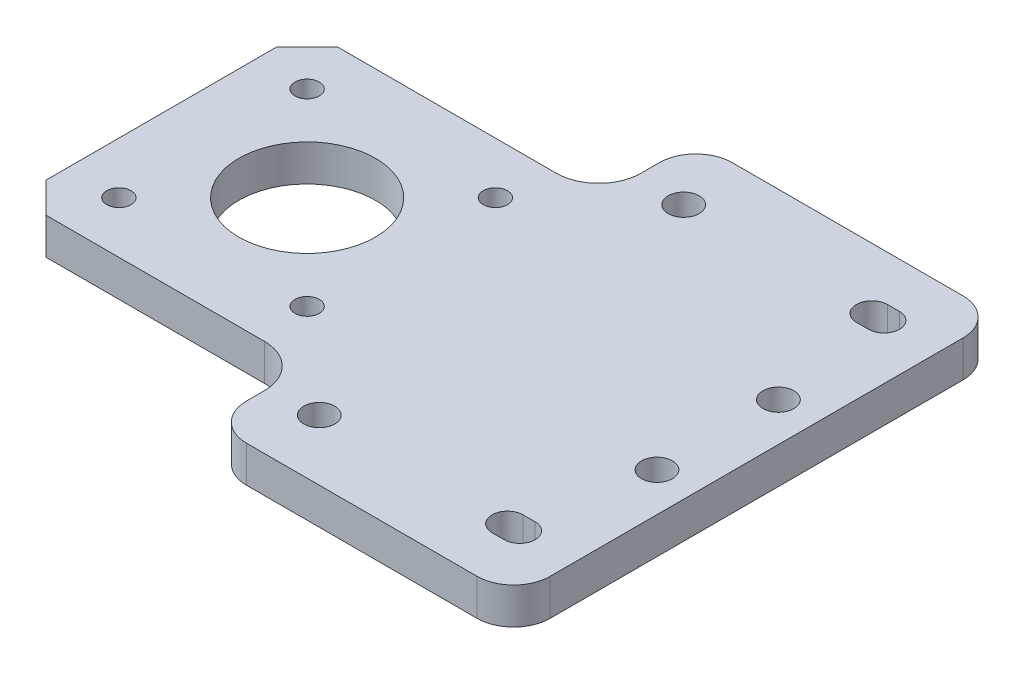
from build123d import *

# Parameters (mm, degrees)
SKETCH_1_R          = 11.25
SKETCH_1_R_2        = 2
SKETCH_1_R_3        = 2.55
EXTRUDE_1_DEPTH     = 6
SKETCH_2_R          = 2.55
CUT_EXTRUDE_1_DEPTH = 84.456575535


with BuildPart() as part:
    # Эскиз1 → Бобышка-Вытянуть1 (new body)
    with BuildSketch(Plane(origin=(0, 0, 0), x_dir=(1, 0, 0), z_dir=(0, 1, 0))):
        with BuildLine():
            Line((-32, -24), (-68, -24))
            Line((-68, -24), (-73, -19))
            Line((-73, -19), (-73, 19))
            Line((-73, 19), (-68, 24))
            Line((-68, 24), (-32, 24))
            ThreePointArc((-32, 24), (-27.050252532, 26.050252532), (-25, 31))
            Line((-25, 31), (-25, 34))
            ThreePointArc((-25, 34), (-23.242640687, 38.242640687), (-19, 40))
            Line((-19, 40), (19, 40))
            ThreePointArc((19, 40), (23.242640687, 38.242640687), (25, 34))
            Line((25, 34), (25, -34))
            ThreePointArc((25, -34), (23.242640687, -38.242640687), (19, -40))
            Line((19, -40), (-19, -40))
            ThreePointArc((-19, -40), (-23.242640687, -38.242640687), (-25, -34))
            Line((-25, -34), (-25, -31))
            ThreePointArc((-25, -31), (-27.050252532, -26.050252532), (-32, -24))
        make_face()
        with Locations((-49, 0)):
            Circle(SKETCH_1_R, mode=Mode.SUBTRACT)
        with Locations((-64.5, 15.5)):
            Circle(SKETCH_1_R_2, mode=Mode.SUBTRACT)
        with Locations((-64.5, -15.5)):
            Circle(SKETCH_1_R_2, mode=Mode.SUBTRACT)
        with Locations((-33.5, 15.5)):
            Circle(SKETCH_1_R_2, mode=Mode.SUBTRACT)
        with Locations((-33.5, -15.5)):
            Circle(SKETCH_1_R_2, mode=Mode.SUBTRACT)
        with Locations((18.604999999, -10)):
            Circle(SKETCH_1_R_3, mode=Mode.SUBTRACT)
        with Locations((18.604999999, 10)):
            Circle(SKETCH_1_R_3, mode=Mode.SUBTRACT)
    extrude(amount=EXTRUDE_1_DEPTH)

    # Эскиз2 → Вырез-Вытянуть1 (cut, through all)
    with BuildSketch(Plane.XZ):
        with Locations((-17, -30)):
            Circle(SKETCH_2_R)
        with Locations((-17, 30)):
            Circle(SKETCH_2_R)
        with BuildLine():
            Line((16, -32.55), (14, -32.55))
            ThreePointArc((14, -32.55), (11.45, -30), (14, -27.45))
            Line((14, -27.45), (16, -27.45))
            ThreePointArc((16, -27.45), (18.55, -30), (16, -32.55))
        make_face()
        with BuildLine():
            Line((16, 32.55), (14, 32.55))
            ThreePointArc((14, 32.55), (11.45, 30), (14, 27.45))
            Line((14, 27.45), (16, 27.45))
            ThreePointArc((16, 27.45), (18.55, 30), (16, 32.55))
        make_face()
    extrude(amount=-CUT_EXTRUDE_1_DEPTH, mode=Mode.SUBTRACT)


solid = part.part
